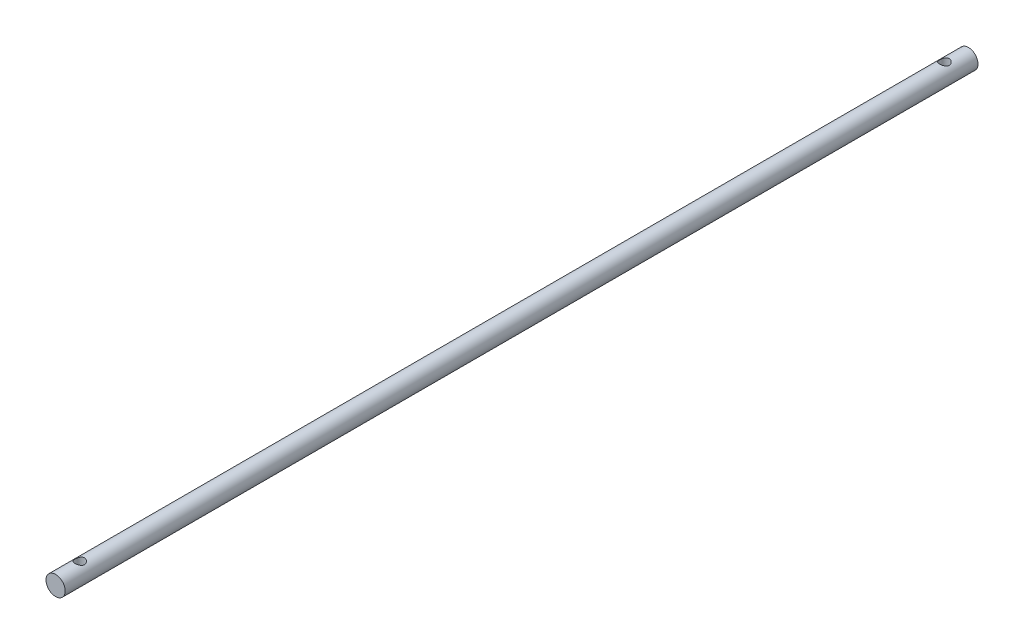
from build123d import *

# Parameters (mm, degrees)
SKETCH1_R                         = 4
EXTRUDE1_DEPTH                    = 380
SKETCH3_W                         = 2
SKETCH3_H                         = 4
F_4_0_4_DIAMETER_HOLE1_AT_2_COUNT = 2
F_4_0_4_DIAMETER_HOLE1_AT_2_PITCH = 360


with BuildPart() as part:
    # Sketch1 → Extrude1 (new body)
    with BuildSketch(Plane.XY):
        Circle(SKETCH1_R)
    extrude(amount=EXTRUDE1_DEPTH)

    # Sketch3 → Ø4.0 (4) Diameter Hole1 (revolve, cut)
    with BuildSketch(Plane(origin=(0, 0, 10), x_dir=(0, 0, -1), z_dir=(1, 0, 0))):
        with Locations((1, 2)):
            Rectangle(SKETCH3_W, SKETCH3_H)
    f_4_0_4_diameter_hole1 = revolve(axis=Axis((0, -6.35, 10), (0, 1, 0)), mode=Mode.SUBTRACT)

    # Ø4.0 (4) Diameter Hole1 at 2: Ø4.0 (4) Diameter Hole1 ×2
    with Locations(*[(0, 0, i * F_4_0_4_DIAMETER_HOLE1_AT_2_PITCH) for i in range(1, F_4_0_4_DIAMETER_HOLE1_AT_2_COUNT)]):
        add(f_4_0_4_diameter_hole1, mode=Mode.SUBTRACT)


solid = part.part
